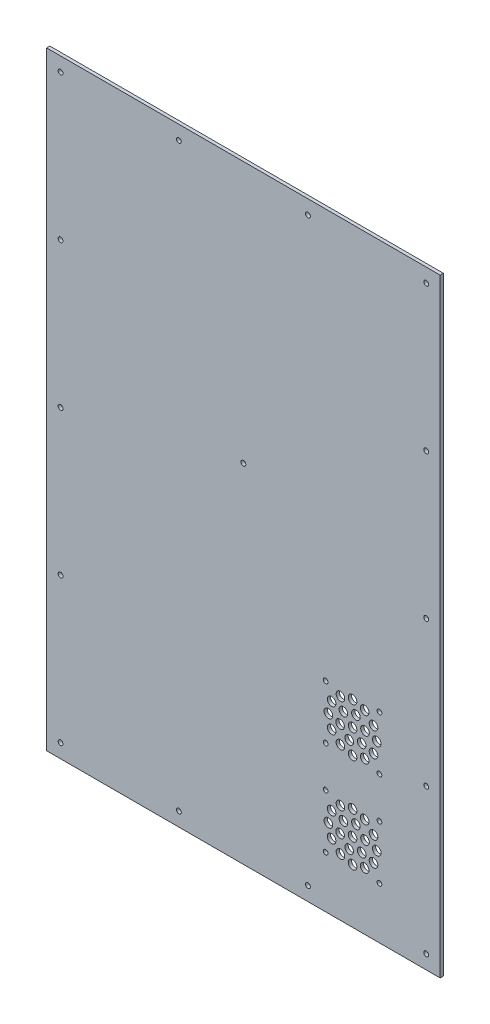
from build123d import *

# Parameters (mm, degrees)
SKETCH_1_W          = 366
SKETCH_1_H          = 566
EXTRUDE_1_DEPTH     = 3
SKETCH_5_R          = 2.25
CUT_EXTRUDE_2_DEPTH = 675.033381963
SKETCH1_R           = 2.25
CUT_EXTRUDE1_DEPTH  = 675.033381963
SKETCH_6_R          = 4
SKETCH_6_R_2        = 2.2
CUT_EXTRUDE_3_DEPTH = 675.033381963


with BuildPart() as part:
    # Эскиз1 → Бобышка-Вытянуть1 (new body)
    with BuildSketch(Plane.XY):
        with Locations((183, 283)):
            Rectangle(SKETCH_1_W, SKETCH_1_H)
    extrude(amount=EXTRUDE_1_DEPTH)

    # Эскиз5 → Вырез-Вытянуть2 (cut, through all)
    with BuildSketch(Plane(origin=(0, 0, 0), x_dir=(-1, 0, 0), z_dir=(0, 0, -1))):
        with Locations((-353, 553)):
            Circle(SKETCH_5_R)
        with Locations((-13, 553)):
            Circle(SKETCH_5_R)
        with Locations((-243, 553)):
            Circle(SKETCH_5_R)
        with Locations((-123, 553)):
            Circle(SKETCH_5_R)
        with Locations((-353, 418)):
            Circle(SKETCH_5_R)
        with Locations((-353, 283)):
            Circle(SKETCH_5_R)
        with Locations((-353, 148)):
            Circle(SKETCH_5_R)
        with Locations((-353, 13)):
            Circle(SKETCH_5_R)
        with Locations((-123, 13)):
            Circle(SKETCH_5_R)
        with Locations((-243, 13)):
            Circle(SKETCH_5_R)
        with Locations((-13, 418)):
            Circle(SKETCH_5_R)
        with Locations((-13, 283)):
            Circle(SKETCH_5_R)
        with Locations((-13, 148)):
            Circle(SKETCH_5_R)
        with Locations((-13, 13)):
            Circle(SKETCH_5_R)
    extrude(amount=-CUT_EXTRUDE_2_DEPTH, mode=Mode.SUBTRACT)

    # Sketch1 → Cut-Extrude1 (cut, through all)
    with BuildSketch(Plane.XY.offset(3)):
        with Locations((183, 323)):
            Circle(SKETCH1_R)
    extrude(amount=-CUT_EXTRUDE1_DEPTH, mode=Mode.SUBTRACT)

    # Эскиз6 → Вырез-Вытянуть3 (cut, through all)
    with BuildSketch(Plane(origin=(0, 0, 0), x_dir=(-1, 0, 0), z_dir=(0, 0, -1))):
        with Locations((-284.5, 50.5)):
            Circle(SKETCH_6_R)
        with Locations((-295.75, 53.514428415)):
            Circle(SKETCH_6_R)
        with Locations((-303.985571585, 61.75)):
            Circle(SKETCH_6_R)
        with Locations((-307, 73)):
            Circle(SKETCH_6_R)
        with Locations((-303.985571585, 84.25)):
            Circle(SKETCH_6_R)
        with Locations((-295.75, 92.485571585)):
            Circle(SKETCH_6_R)
        with Locations((-284.5, 95.5)):
            Circle(SKETCH_6_R)
        with Locations((-273.25, 92.485571585)):
            Circle(SKETCH_6_R)
        with Locations((-265.014428415, 84.25)):
            Circle(SKETCH_6_R)
        with Locations((-262, 73)):
            Circle(SKETCH_6_R)
        with Locations((-281.394171459, 61.408890085)):
            Circle(SKETCH_6_R)
        with Locations((-292.985281374, 64.514718626)):
            Circle(SKETCH_6_R)
        with Locations((-296.091109915, 76.105828541)):
            Circle(SKETCH_6_R)
        with Locations((-287.605828541, 84.591109915)):
            Circle(SKETCH_6_R)
        with Locations((-276.014718626, 81.485281374)):
            Circle(SKETCH_6_R)
        with Locations((-284.5, 73)):
            Circle(SKETCH_6_R)
        with Locations((-265.014428415, 61.75)):
            Circle(SKETCH_6_R)
        with Locations((-272.908890085, 69.894171459)):
            Circle(SKETCH_6_R)
        with Locations((-273.25, 53.514428415)):
            Circle(SKETCH_6_R)
        with Locations((-284.5, 138.5)):
            Circle(SKETCH_6_R)
        with Locations((-295.75, 141.514428415)):
            Circle(SKETCH_6_R)
        with Locations((-303.985571585, 149.75)):
            Circle(SKETCH_6_R)
        with Locations((-307, 161)):
            Circle(SKETCH_6_R)
        with Locations((-303.985571585, 172.25)):
            Circle(SKETCH_6_R)
        with Locations((-295.75, 180.485571585)):
            Circle(SKETCH_6_R)
        with Locations((-284.5, 183.5)):
            Circle(SKETCH_6_R)
        with Locations((-273.25, 180.485571585)):
            Circle(SKETCH_6_R)
        with Locations((-265.014428415, 172.25)):
            Circle(SKETCH_6_R)
        with Locations((-262, 161)):
            Circle(SKETCH_6_R)
        with Locations((-265.014428415, 149.75)):
            Circle(SKETCH_6_R)
        with Locations((-273.25, 141.514428415)):
            Circle(SKETCH_6_R)
        with Locations((-292.985281374, 152.514718626)):
            Circle(SKETCH_6_R)
        with Locations((-296.091109915, 164.105828541)):
            Circle(SKETCH_6_R)
        with Locations((-287.605828541, 172.591109915)):
            Circle(SKETCH_6_R)
        with Locations((-276.014718626, 169.485281374)):
            Circle(SKETCH_6_R)
        with Locations((-272.908890085, 157.894171459)):
            Circle(SKETCH_6_R)
        with Locations((-281.394171459, 149.408890085)):
            Circle(SKETCH_6_R)
        with Locations((-284.5, 161)):
            Circle(SKETCH_6_R)
        with Locations((-309.5, 98)):
            Circle(SKETCH_6_R_2)
        with Locations((-259.5, 98)):
            Circle(SKETCH_6_R_2)
        with Locations((-259.5, 48)):
            Circle(SKETCH_6_R_2)
        with Locations((-309.5, 48)):
            Circle(SKETCH_6_R_2)
        with Locations((-309.5, 186)):
            Circle(SKETCH_6_R_2)
        with Locations((-259.5, 186)):
            Circle(SKETCH_6_R_2)
        with Locations((-259.5, 136)):
            Circle(SKETCH_6_R_2)
        with Locations((-309.5, 136)):
            Circle(SKETCH_6_R_2)
    extrude(amount=-CUT_EXTRUDE_3_DEPTH, mode=Mode.SUBTRACT)


solid = part.part
